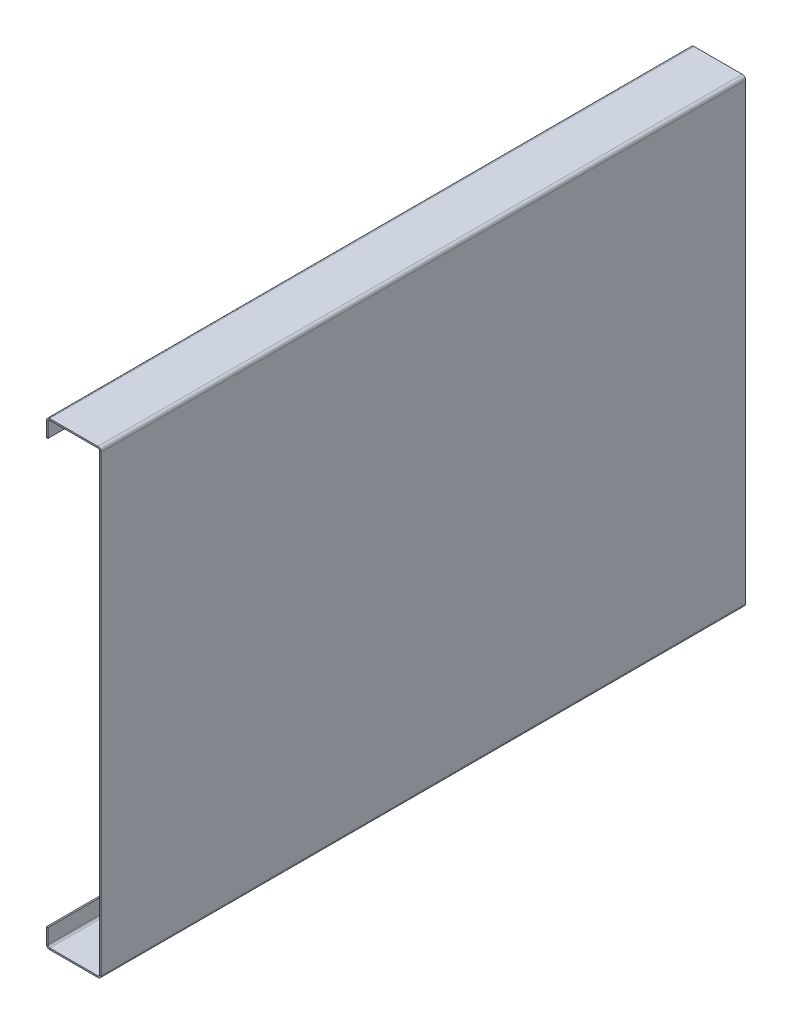
from build123d import *

# Parameters (mm, degrees)
SKETCH1_W              = 323.6
SKETCH1_H              = 350
BASE_FLANGE1_DEPTH     = 0.8
SKETCHED_START         = -175
SKETCHED_BEND3_DEPTH   = 350
SKETCHED_BEND3_2_DEPTH = 350


# Read off the part's stored shape, not the designer's step: Sketched Bend3
# Sheet-metal steps are written as plain solids
with BuildPart() as part:
    # Sketch1 → Base-Flange1 (new body)
    with BuildSketch(Plane(origin=(0, 0, 0), x_dir=(1, 0, 0), z_dir=(0, 1, 0))):
        Rectangle(SKETCH1_W, SKETCH1_H)
    extrude(amount=BASE_FLANGE1_DEPTH)

    # Sketched Bend3 outline → Sketched Bend3 (cut)
    with BuildSketch(Plane.XY.offset(SKETCHED_START)):
        with BuildLine():
            Line((161.8, 0.8), (-123.802894475, 0.8))
            ThreePointArc((-123.802894475, 0.8), (-124.451029292, 0.212549213), (-125.299557429, 0))
            Line((-125.299557429, 0), (161.8, 0))
            Line((161.8, 0), (161.8, 0.8))
        make_face()
        with BuildLine():
            Line((-161.8, 0), (-151.500442571, 0))
            ThreePointArc((-151.500442571, 0), (-152.348970708, 0.212549213), (-152.997105525, 0.8))
            Line((-152.997105525, 0.8), (-161.8, 0.8))
            Line((-161.8, 0.8), (-161.8, 0))
        make_face()
    extrude(amount=SKETCHED_BEND3_DEPTH, mode=Mode.SUBTRACT)

    # Sketched Bend3 2 outline → Sketched Bend3 2 (add)
    with BuildSketch(Plane.XY.offset(SKETCHED_START)):
        with BuildLine():
            ThreePointArc((-123.802894475, 0.8), (-123.577060213, 1.277502784), (-123.499557429, 1.8))
            Line((-123.499557429, 1.8), (-123.499557429, 248.000885142))
            ThreePointArc((-123.499557429, 248.000885142), (-124.026765223, 249.273677349), (-125.299557429, 249.800885142))
            Line((-125.299557429, 249.800885142), (-151.500442571, 249.800885142))
            ThreePointArc((-151.500442571, 249.800885142), (-152.773234777, 249.273677348), (-153.300442571, 248.000885142))
            Line((-153.300442571, 248.000885142), (-153.300442571, 239.900442571))
            Line((-153.300442571, 239.900442571), (-152.500442571, 239.900442571))
            Line((-152.500442571, 239.900442571), (-152.500442571, 248.000885142))
            ThreePointArc((-152.500442571, 248.000885142), (-152.207549352, 248.707991924), (-151.500442571, 249.000885142))
            Line((-151.500442571, 249.000885142), (-125.299557429, 249.000885142))
            ThreePointArc((-125.299557429, 249.000885142), (-124.592450648, 248.707991924), (-124.299557429, 248.000885142))
            Line((-124.299557429, 248.000885142), (-124.299557429, 1.8))
            ThreePointArc((-124.299557429, 1.8), (-124.592450648, 1.092893219), (-125.299557429, 0.8))
            Line((-125.299557429, 0.8), (-123.802894475, 0.8))
        make_face()
        with BuildLine():
            Line((-152.997105525, 0.8), (-151.500442571, 0.8))
            ThreePointArc((-151.500442571, 0.8), (-152.207549352, 1.092893219), (-152.500442571, 1.8))
            Line((-152.500442571, 1.8), (-152.500442571, 9.900442571))
            Line((-152.500442571, 9.900442571), (-153.300442571, 9.900442571))
            Line((-153.300442571, 9.900442571), (-153.300442571, 1.8))
            ThreePointArc((-153.300442571, 1.8), (-153.222939787, 1.277502784), (-152.997105525, 0.8))
        make_face()
    extrude(amount=SKETCHED_BEND3_2_DEPTH)


solid = part.part
